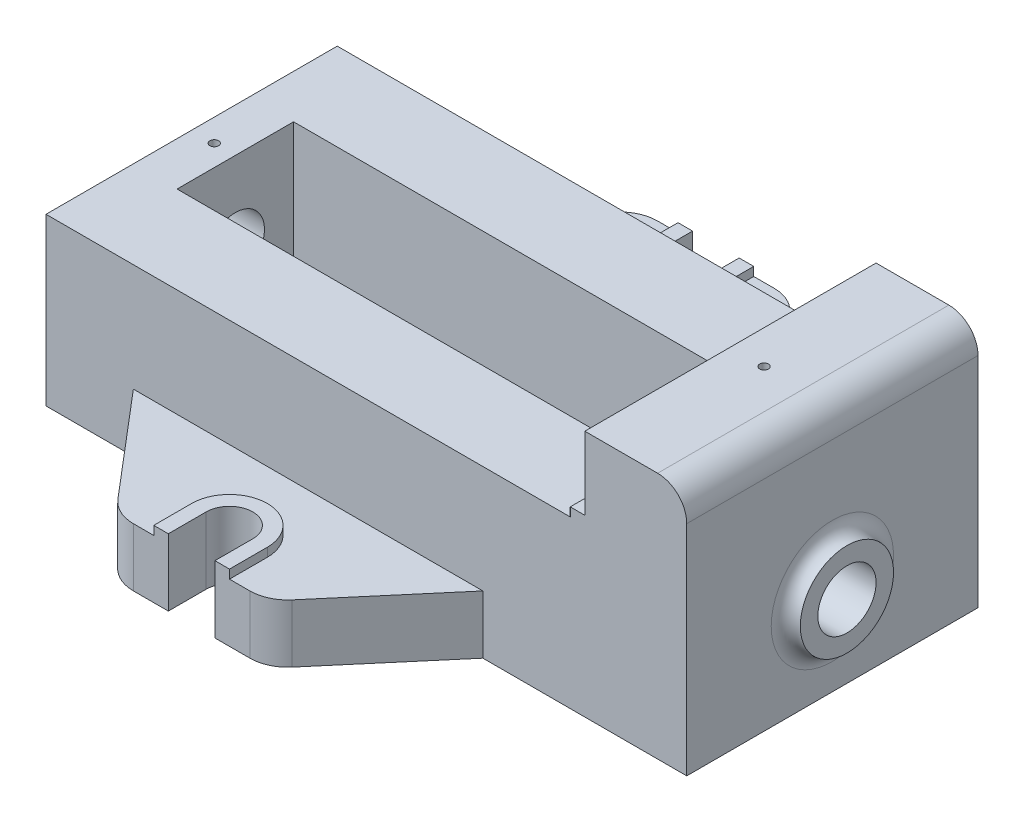
from build123d import *

# Parameters (mm, degrees)
SKETCH1_W                   = 180
SKETCH1_H                   = 100
BOSS_EXTRUDE1_DEPTH         = 57
BOSS_EXTRUDE2_DEPTH         = 20
BOSS_EXTRUDE3_DEPTH         = 3
CUT_EXTRUDE2_DEPTH          = 132.742172443
CUT_EXTRUDE2_DEPTH_BACK     = 23
CUT_EXTRUDE3_DEPTH          = 132.742172443
CUT_EXTRUDE3_DEPTH_BACK     = 23
BOSS_EXTRUDE4_DEPTH         = 50
SKETCH8_R                   = 16
BOSS_EXTRUDE5_DEPTH         = 5
BOSS_EXTRUDE6_START         = 5
SKETCH11_R                  = 16
BOSS_EXTRUDE6_DEPTH         = 5
SKETCH13_W                  = 165
SKETCH13_H                  = 40
CUT_EXTRUDE6_DEPTH          = 172.970927776
M6_TAPPED_HOLE1_D           = 5
M6_TAPPED_HOLE1_DEPTH       = 13
M6_TAPPED_HOLE1_CSINK_D     = 6.05
M6_TAPPED_HOLE1_CSINK_ANGLE = 90
M6_TAPPED_HOLE1_TIP         = 1.502151548
FILLET4_R                   = 5
SKETCH17_R                  = 10
CUT_EXTRUDE7_DEPTH          = 40
FILLET5_R                   = 5
CUT_EXTRUDE8_START          = -115
SKETCH18_R                  = 10
CUT_EXTRUDE8_DEPTH          = 115
SKETCH19_R                  = 1.5
CUT_EXTRUDE9_DEPTH          = 15
SKETCH20_R                  = 1.5
CUT_EXTRUDE10_DEPTH         = 46


with BuildPart() as part:
    # Sketch1 → Boss-Extrude1 (new body)
    with BuildSketch(Plane(origin=(0, 0, 0), x_dir=(1, 0, 0), z_dir=(0, 1, 0))):
        Rectangle(SKETCH1_W, SKETCH1_H)
    extrude(amount=BOSS_EXTRUDE1_DEPTH)

    # Sketch2 → Boss-Extrude2 (add)
    with BuildSketch(Plane(origin=(0, 0, 0), x_dir=(1, 0, 0), z_dir=(0, 1, 0))):
        with BuildLine():
            Line((-60, -50), (60, -50))
            Line((60, -50), (29.906829478, -85.417525153))
            ThreePointArc((29.906829478, -85.417525153), (25.4576631, -88.798894588), (20, -90))
            Line((20, -90), (8, -90))
            Line((8, -90), (-8, -90))
            Line((-8, -90), (-20, -90))
            ThreePointArc((-20, -90), (-25.4576631, -88.798894588), (-29.906829478, -85.417525153))
            Line((-29.906829478, -85.417525153), (-60, -50))
        make_face()
    boss_extrude2 = extrude(amount=BOSS_EXTRUDE2_DEPTH)

    # Sketch3 → Boss-Extrude3 (add)
    with BuildSketch(Plane(origin=(0, 20, 0), x_dir=(1, 0, 0), z_dir=(0, 1, 0))):
        with BuildLine():
            Line((-13, -77), (-13, -90))
            Line((-13, -90), (13, -90))
            Line((13, -90), (13, -77))
            ThreePointArc((13, -77), (0, -64), (-13, -77))
        make_face()
    boss_extrude3 = extrude(amount=BOSS_EXTRUDE3_DEPTH)

    # Sketch4 → Cut-Extrude2 (cut, two sides: drawn at the far end of the back side and taken through both)
    with BuildSketch(Plane(origin=(0, 23, 0), x_dir=(1, 0, 0), z_dir=(0, 1, 0)).offset(-CUT_EXTRUDE2_DEPTH_BACK)):
        with BuildLine():
            Line((-8, -441.783557241), (-8, -90))
            Line((-8, -90), (-8, -77))
            ThreePointArc((-8, -77), (0, -69), (8, -77))
            Line((8, -77), (8, -90))
            Line((8, -90), (8, -441.783557241))
            Line((8, -441.783557241), (8, -1145.350671722))
            Line((8, -1145.350671722), (-8, -1145.350671722))
            Line((-8, -1145.350671722), (-8, -441.783557241))
        make_face()
    extrude(amount=CUT_EXTRUDE2_DEPTH + CUT_EXTRUDE2_DEPTH_BACK, mode=Mode.SUBTRACT)

    # Mirror5: Boss-Extrude2 across plane
    add(boss_extrude2.mirror(Plane.XY))

    # Mirror6: Boss-Extrude3 across plane
    add(boss_extrude3.mirror(Plane.XY))

    # Sketch5 → Cut-Extrude3 (cut, two sides: drawn at the far end of the back side and taken through both)
    with BuildSketch(Plane(origin=(0, 23, 0), x_dir=(1, 0, 0), z_dir=(0, 1, 0)).offset(-CUT_EXTRUDE3_DEPTH_BACK)):
        with BuildLine():
            Line((-8, 90), (-8, 77))
            ThreePointArc((-8, 77), (0, 69), (8, 77))
            Line((8, 77), (8, 90))
            Line((8, 90), (-8, 90))
        make_face()
    extrude(amount=CUT_EXTRUDE3_DEPTH + CUT_EXTRUDE3_DEPTH_BACK, mode=Mode.SUBTRACT)

    # Sketch6 → Boss-Extrude4 (add, symmetric)
    with BuildSketch(Plane.XY):
        with BuildLine():
            Line((90, 0), (130, 0))
            Line((130, 0), (130, 75))
            ThreePointArc((130, 75), (127.071067812, 82.071067812), (120, 85))
            Line((120, 85), (95, 85))
            Line((95, 85), (95, 60))
            Line((95, 60), (90, 60))
            Line((90, 60), (90, 57))
            Line((90, 57), (90, 0))
        make_face()
    extrude(amount=BOSS_EXTRUDE4_DEPTH, both=True)

    # Sketch8 → Boss-Extrude5 (add)
    with BuildSketch(Plane(origin=(130, 0, 0), x_dir=(0, 0, -1), z_dir=(1, 0, 0))):
        with Locations(Location((0, 30, 0), (0, 0, 180))):
            Circle(SKETCH8_R)
    extrude(amount=BOSS_EXTRUDE5_DEPTH)

    # Sketch11 → Boss-Extrude6 (add)
    with BuildSketch(Plane.ZY.offset(90).offset(BOSS_EXTRUDE6_START)):
        with Locations((0, 30)):
            Circle(SKETCH11_R)
    extrude(amount=-BOSS_EXTRUDE6_DEPTH)

    # Sketch13 → Cut-Extrude6 (cut, through all)
    with BuildSketch(Plane(origin=(0, 57, 0), x_dir=(1, 0, 0), z_dir=(0, 1, 0))):
        with Locations((7.5, 0)):
            Rectangle(SKETCH13_W, SKETCH13_H)
    extrude(amount=-CUT_EXTRUDE6_DEPTH, mode=Mode.SUBTRACT)

    # M6 Tapped Hole1
    with Locations(Plane(origin=(95, 72.5, -30), x_dir=(0, 0, -1), z_dir=(-1, 0, 0))):
        with Locations((0, 0), (-60, 0)):
            CounterSinkHole(M6_TAPPED_HOLE1_D / 2, M6_TAPPED_HOLE1_CSINK_D / 2, depth=M6_TAPPED_HOLE1_DEPTH, counter_sink_angle=M6_TAPPED_HOLE1_CSINK_ANGLE)
            with Locations((0, 0, -(M6_TAPPED_HOLE1_DEPTH + M6_TAPPED_HOLE1_TIP / 2))):  # 118° drill point
                Cone(0, M6_TAPPED_HOLE1_D / 2, M6_TAPPED_HOLE1_TIP, mode=Mode.SUBTRACT)

    # Fillet4
    fillet4_edges = [part.edges().sort_by_distance(p)[0] for p in [
        (-90, 30, -16),
    ]]
    fillet(fillet4_edges, radius=FILLET4_R - 0.0001)  # a hair under: the kernel refuses the full size

    # Sketch17 → Cut-Extrude7 (cut)
    with BuildSketch(Plane.ZY.offset(95)):
        with Locations((0, 30)):
            Circle(SKETCH17_R)
    extrude(amount=-CUT_EXTRUDE7_DEPTH, mode=Mode.SUBTRACT)

    # Fillet5
    fillet5_edges = [part.edges().sort_by_distance(p)[0] for p in [
        (130, 30, -16),
    ]]
    fillet(fillet5_edges, radius=FILLET5_R - 0.0001)  # a hair under: the kernel refuses the full size

    # Sketch18 → Cut-Extrude8 (cut)
    with BuildSketch(Plane(origin=(135, 0, 0), x_dir=(0, 0, -1), z_dir=(1, 0, 0)).offset(CUT_EXTRUDE8_START)):
        with Locations(Location((0, 30, 0), (0, 0, 180))):
            Circle(SKETCH18_R)
    extrude(amount=CUT_EXTRUDE8_DEPTH, mode=Mode.SUBTRACT)

    # Sketch19 → Cut-Extrude9 (cut)
    with BuildSketch(Plane(origin=(0, 57, 0), x_dir=(1, 0, 0), z_dir=(0, 1, 0))):
        with Locations(Location((-82.230390489, 0, 0), (0, 0, 270))):
            Circle(SKETCH19_R)
    extrude(amount=-CUT_EXTRUDE9_DEPTH, mode=Mode.SUBTRACT)

    # Sketch20 → Cut-Extrude10 (cut)
    with BuildSketch(Plane(origin=(0, 85, 0), x_dir=(1, 0, 0), z_dir=(0, 1, 0))):
        with Locations(Location((106.54731922, 0, 0), (0, 0, 270))):
            Circle(SKETCH20_R)
    extrude(amount=-CUT_EXTRUDE10_DEPTH, mode=Mode.SUBTRACT)


solid = part.part
